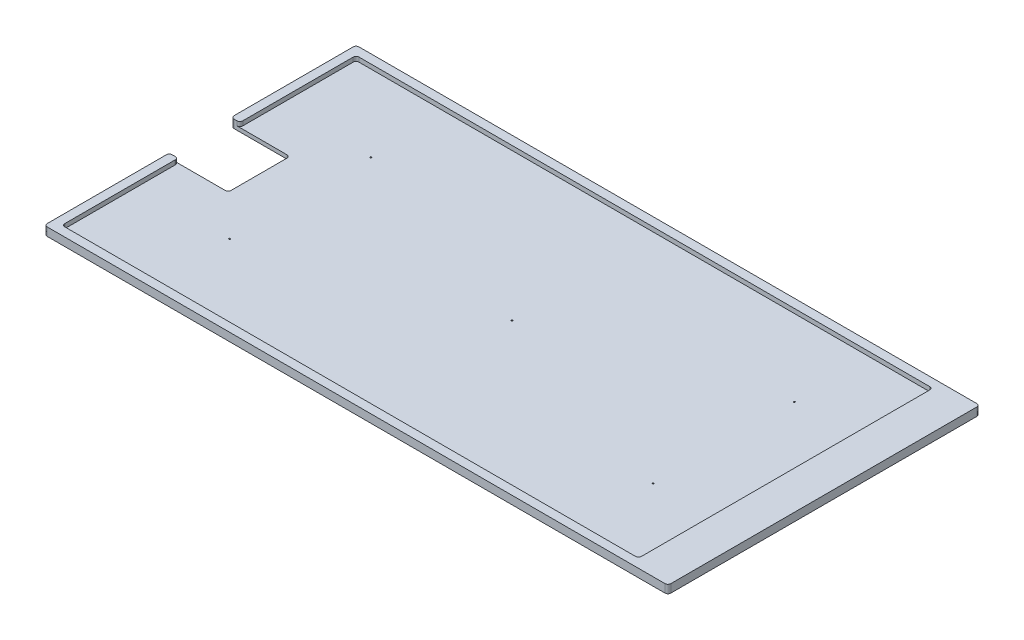
from build123d import *

# Parameters (mm, degrees)
SKETCH1_W                    = 1346.2
SKETCH1_H                    = 673.1
BOSS_EXTRUDE1_DEPTH          = 17.78
F_1_8_0_125_DIAMETER_HOLE1_D = 3.175
SKETCH4_W                    = 127
SKETCH4_H                    = 133.35
CUT_EXTRUDE1_DEPTH           = 753.758687031
SKETCH5_W                    = 1244.6
SKETCH5_H                    = 635
CUT_EXTRUDE2_DEPTH           = 9.525
FILLET1_R                    = 6.35


with BuildPart() as part:
    # Sketch1 → Boss-Extrude1 (new body)
    with BuildSketch(Plane(origin=(0, 0, 0), x_dir=(1, 0, 0), z_dir=(0, 1, 0))):
        Rectangle(SKETCH1_W, SKETCH1_H)
    extrude(amount=BOSS_EXTRUDE1_DEPTH)

    # 1/8 (0.125) Diameter Hole1 (through all)
    with Locations(Plane(origin=(0, 17.78, 0), x_dir=(1, 0, 0), z_dir=(0, 1, 0))):
        with Locations((0, 0), (457.2, 152.4), (-457.2, -152.4), (-457.2, 152.4), (457.2, -152.4)):
            Hole(F_1_8_0_125_DIAMETER_HOLE1_D / 2)

    # Sketch4 → Cut-Extrude1 (cut, through all)
    with BuildSketch(Plane(origin=(0, 17.78, 0), x_dir=(1, 0, 0), z_dir=(0, 1, 0))):
        with Locations((-609.6, 0)):
            Rectangle(SKETCH4_W, SKETCH4_H)
    extrude(amount=-CUT_EXTRUDE1_DEPTH, mode=Mode.SUBTRACT)

    # Sketch5 → Cut-Extrude2 (cut)
    with BuildSketch(Plane(origin=(0, 17.78, 0), x_dir=(1, 0, 0), z_dir=(0, 1, 0))):
        with Locations((-31.75, 0)):
            Rectangle(SKETCH5_W, SKETCH5_H)
    extrude(amount=-CUT_EXTRUDE2_DEPTH, mode=Mode.SUBTRACT)

    # Fillet1
    fillet1_edges = [part.edges().sort_by_distance(p)[0] for p in [
        (673.1, 8.89, -336.55),
        (673.1, 8.89, 336.55),
        (-673.1, 8.89, 336.55),
        (-673.1, 8.89, -336.55),
        (-673.1, 8.89, 66.675),
        (-546.1, 4.1275, 66.675),
        (-673.1, 8.89, -66.675),
        (-546.1, 4.1275, -66.675),
        (-654.05, 13.0175, 317.5),
        (590.55, 13.0175, 317.5),
        (590.55, 13.0175, -317.5),
        (-654.05, 13.0175, -317.5),
        (-654.05, 13.0175, 66.675),
        (-654.05, 13.0175, -66.675),
    ]]
    fillet(fillet1_edges, radius=FILLET1_R)


solid = part.part
